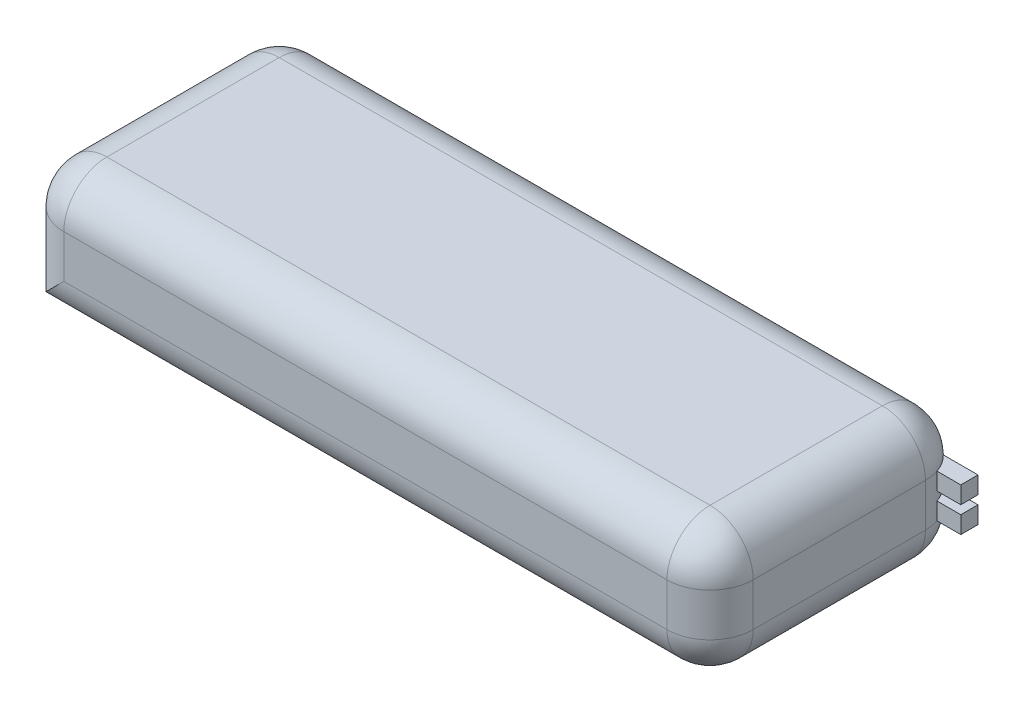
from build123d import *

# Parameters (mm, degrees)
ESQUISSE1_W        = 160
ESQUISSE1_H        = 60
BOSS_EXTRU_1_DEPTH = 30
ESQUISSE2_W        = 4
ESQUISSE2_H        = 4
BOSS_EXTRU_2_DEPTH = 5
CONG_1_R           = 10


with BuildPart() as part:
    # Esquisse1 → Boss.-Extru.1 (new body)
    with BuildSketch(Plane(origin=(0, 0, 0), x_dir=(1, 0, 0), z_dir=(0, 1, 0))):
        Rectangle(ESQUISSE1_W, ESQUISSE1_H)
    extrude(amount=BOSS_EXTRU_1_DEPTH)

    # Esquisse2 → Boss.-Extru.2 (add)
    with BuildSketch(Plane(origin=(80, 0, 0), x_dir=(0, 0, -1), z_dir=(1, 0, 0))):
        with Locations((25.192260315, 18)):
            Rectangle(ESQUISSE2_W, ESQUISSE2_H)
        with Locations((25.192260315, 12)):
            Rectangle(ESQUISSE2_W, ESQUISSE2_H)
    extrude(amount=BOSS_EXTRU_2_DEPTH)

    # Congé1
    # the kernel refuses this fillet: 10 mm, written as the material it takes off along each edge
    with BuildSketch(Plane(origin=(-70, 20, 20), x_dir=(-1, 0, 0), z_dir=(0, 0, 1))) as cong_1_piece_1_section:
        Polygon((0, 0), (CONG_1_R * 1.02, 0), (CONG_1_R * 1.02, -CONG_1_R * 1.02), (0, -CONG_1_R * 1.02), align=None)
    cong_1_piece_1 = extrude(amount=CONG_1_R * 1.02, mode=Mode.PRIVATE)
    cong_1_piece_1 = cong_1_piece_1 - Plane(origin=(-70, 20, 20), x_dir=(0.7071067811865475, -0.7071067811865475, 0), z_dir=(0, 0, 1)) * Sphere(CONG_1_R, mode=Mode.PRIVATE)
    add(cong_1_piece_1, mode=Mode.SUBTRACT)
    with BuildSketch(Plane(origin=(-70, 20, -20), x_dir=(0, 1, 0), z_dir=(-1, 0, 0))) as cong_1_piece_2_section:
        Polygon((0, 0), (CONG_1_R * 1.02, 0), (CONG_1_R * 1.02, CONG_1_R * 1.02), (0, CONG_1_R * 1.02), align=None)
    cong_1_piece_2 = extrude(amount=CONG_1_R * 1.02, mode=Mode.PRIVATE)
    cong_1_piece_2 = cong_1_piece_2 - Plane(origin=(-70, 20, -20), x_dir=(0, -0.7071067811865475, 0.7071067811865475), z_dir=(-1, 0, 0)) * Sphere(CONG_1_R, mode=Mode.PRIVATE)
    add(cong_1_piece_2, mode=Mode.SUBTRACT)
    with BuildSketch(Plane(origin=(70, 10, -20), x_dir=(0, -1, 0), z_dir=(1, 0, 0))) as cong_1_piece_3_section:
        Polygon((0, 0), (CONG_1_R * 1.02, 0), (CONG_1_R * 1.02, CONG_1_R * 1.02), (0, CONG_1_R * 1.02), align=None)
    cong_1_piece_3 = extrude(amount=CONG_1_R * 1.02, mode=Mode.PRIVATE)
    cong_1_piece_3 = cong_1_piece_3 - Plane(origin=(70, 10, -20), x_dir=(0, 0.7071067811865475, 0.7071067811865475), z_dir=(1, 0, 0)) * Sphere(CONG_1_R, mode=Mode.PRIVATE)
    add(cong_1_piece_3, mode=Mode.SUBTRACT)
    with BuildSketch(Plane(origin=(70, 20, -20), x_dir=(0, 1, 0), z_dir=(1, 0, 0))) as cong_1_piece_4_section:
        Polygon((0, 0), (CONG_1_R * 1.02, 0), (CONG_1_R * 1.02, -CONG_1_R * 1.02), (0, -CONG_1_R * 1.02), align=None)
    cong_1_piece_4 = extrude(amount=CONG_1_R * 1.02, mode=Mode.PRIVATE)
    cong_1_piece_4 = cong_1_piece_4 - Plane(origin=(70, 20, -20), x_dir=(0, -0.7071067811865475, 0.7071067811865475), z_dir=(1, 0, 0)) * Sphere(CONG_1_R, mode=Mode.PRIVATE)
    add(cong_1_piece_4, mode=Mode.SUBTRACT)
    with BuildSketch(Plane(origin=(70, 10, 20), x_dir=(1, 0, 0), z_dir=(0, 0, 1))) as cong_1_piece_5_section:
        Polygon((0, 0), (CONG_1_R * 1.02, 0), (CONG_1_R * 1.02, -CONG_1_R * 1.02), (0, -CONG_1_R * 1.02), align=None)
    cong_1_piece_5 = extrude(amount=CONG_1_R * 1.02, mode=Mode.PRIVATE)
    cong_1_piece_5 = cong_1_piece_5 - Plane(origin=(70, 10, 20), x_dir=(-0.7071067811865475, 0.7071067811865475, 0), z_dir=(0, 0, 1)) * Sphere(CONG_1_R, mode=Mode.PRIVATE)
    add(cong_1_piece_5, mode=Mode.SUBTRACT)
    with BuildSketch(Plane(origin=(70, 20, 20), x_dir=(1, 0, 0), z_dir=(0, 0, 1))) as cong_1_piece_6_section:
        Polygon((0, 0), (CONG_1_R * 1.02, 0), (CONG_1_R * 1.02, CONG_1_R * 1.02), (0, CONG_1_R * 1.02), align=None)
    cong_1_piece_6 = extrude(amount=CONG_1_R * 1.02, mode=Mode.PRIVATE)
    cong_1_piece_6 = cong_1_piece_6 - Plane(origin=(70, 20, 20), x_dir=(-0.7071067811865475, -0.7071067811865475, 0), z_dir=(0, 0, 1)) * Sphere(CONG_1_R, mode=Mode.PRIVATE)
    add(cong_1_piece_6, mode=Mode.SUBTRACT)
    with BuildSketch(Plane(origin=(-80, -25, 30), x_dir=(1, 0, 0), z_dir=(0, 1, 0)), Plane(origin=(-80, -25, -30), x_dir=(0, 0, 1), z_dir=(0, 1, 0))) as cong_1_piece_7:
        with BuildLine():
            CenterArc((CONG_1_R, CONG_1_R), CONG_1_R, 180, 90)
            Line((0, CONG_1_R), (0, 0))
            Line((0, 0), (CONG_1_R, 0))
        make_face()
    extrude(amount=45, mode=Mode.SUBTRACT)
    with BuildSketch(Plane(origin=(70, 0, -30), x_dir=(0, 0, 1), z_dir=(-1, 0, 0))) as cong_1_piece_8:
        with BuildLine():
            CenterArc((CONG_1_R, CONG_1_R), CONG_1_R, 180, 90)
            Line((0, CONG_1_R), (0, 0))
            Line((0, 0), (CONG_1_R, 0))
        make_face()
    extrude(amount=175, mode=Mode.SUBTRACT)
    with BuildSketch(Plane(origin=(80, 10, -30), x_dir=(0, 0, 1), z_dir=(0, 1, 0))) as cong_1_piece_9_section:
        with BuildLine():
            CenterArc((CONG_1_R, -CONG_1_R), CONG_1_R, 90, 90)
            Line((0, -CONG_1_R), (0, 0))
            Line((0, 0), (CONG_1_R, 0))
        make_face()
    cong_1_piece_9 = extrude(amount=10, mode=Mode.PRIVATE)
    cong_1_piece_9 = split(cong_1_piece_9, bisect_by=Plane(origin=(79.843765754, 12, -23.192260315), z_dir=(0, 0, 1)), keep=Keep.TOP, mode=Mode.PRIVATE)
    add(cong_1_piece_9, mode=Mode.SUBTRACT)
    with BuildSketch(Plane(origin=(80, 10, -30), x_dir=(0, 0, 1), z_dir=(0, 1, 0))) as cong_1_piece_10_section:
        with BuildLine():
            CenterArc((CONG_1_R, -CONG_1_R), CONG_1_R, 90, 90)
            Line((0, -CONG_1_R), (0, 0))
            Line((0, 0), (CONG_1_R, 0))
        make_face()
    cong_1_piece_10 = extrude(amount=10, mode=Mode.PRIVATE)
    cong_1_piece_10 = split(cong_1_piece_10, bisect_by=Plane(origin=(77.140541655, 12, -27.192260315), z_dir=(0, 0, -1)), keep=Keep.TOP, mode=Mode.PRIVATE)
    add(cong_1_piece_10, mode=Mode.SUBTRACT)
    with BuildSketch(Plane(origin=(80, 10, -30), x_dir=(0, 0, 1), z_dir=(0, 1, 0))) as cong_1_piece_11_section:
        with BuildLine():
            CenterArc((CONG_1_R, -CONG_1_R), CONG_1_R, 90, 90)
            Line((0, -CONG_1_R), (0, 0))
            Line((0, 0), (CONG_1_R, 0))
        make_face()
    cong_1_piece_11 = extrude(amount=10, mode=Mode.PRIVATE)
    cong_1_piece_11 = split(cong_1_piece_11, bisect_by=Plane(origin=(79.050284637, 16, -25.722845845), z_dir=(0, -1, 0)), keep=Keep.TOP, mode=Mode.PRIVATE)
    cong_1_piece_11 = split(cong_1_piece_11, bisect_by=Plane(origin=(79.050284637, 14, -25.722845845), z_dir=(0, 1, 0)), keep=Keep.TOP, mode=Mode.PRIVATE)
    add(cong_1_piece_11, mode=Mode.SUBTRACT)
    with BuildSketch(Plane(origin=(80, 0, 20), x_dir=(0, 1, 0), z_dir=(0, 0, -1))) as cong_1_piece_12:
        with BuildLine():
            CenterArc((CONG_1_R, -CONG_1_R), CONG_1_R, 90, 90)
            Line((0, -CONG_1_R), (0, 0))
            Line((0, 0), (CONG_1_R, 0))
        make_face()
    extrude(amount=40, mode=Mode.SUBTRACT)
    with BuildSketch(Plane(origin=(80, 30, 20), x_dir=(0, -1, 0), z_dir=(0, 0, -1)), Plane(origin=(-80, 30, -20), x_dir=(0, -1, 0), z_dir=(0, 0, 1))) as cong_1_piece_13:
        with BuildLine():
            CenterArc((CONG_1_R, CONG_1_R), CONG_1_R, 180, 90)
            Line((0, CONG_1_R), (0, 0))
            Line((0, 0), (CONG_1_R, 0))
        make_face()
    extrude(amount=40, mode=Mode.SUBTRACT)
    with BuildSketch(Plane(origin=(70, 30, -30), x_dir=(0, 0, 1), z_dir=(-1, 0, 0))) as cong_1_piece_14:
        with BuildLine():
            CenterArc((CONG_1_R, -CONG_1_R), CONG_1_R, 90, 90)
            Line((0, -CONG_1_R), (0, 0))
            Line((0, 0), (CONG_1_R, 0))
        make_face()
    extrude(amount=140, mode=Mode.SUBTRACT)
    with BuildSketch(Plane(origin=(80, 10, 30), x_dir=(-1, 0, 0), z_dir=(0, 1, 0))) as cong_1_piece_15:
        with BuildLine():
            CenterArc((CONG_1_R, -CONG_1_R), CONG_1_R, 90, 90)
            Line((0, -CONG_1_R), (0, 0))
            Line((0, 0), (CONG_1_R, 0))
        make_face()
    extrude(amount=10, mode=Mode.SUBTRACT)
    with BuildSketch(Plane(origin=(-105, 0, 30), x_dir=(0, 1, 0), z_dir=(1, 0, 0))) as cong_1_piece_16:
        with BuildLine():
            CenterArc((CONG_1_R, -CONG_1_R), CONG_1_R, 90, 90)
            Line((0, -CONG_1_R), (0, 0))
            Line((0, 0), (CONG_1_R, 0))
        make_face()
    extrude(amount=175, mode=Mode.SUBTRACT)
    with BuildSketch(Plane(origin=(-70, 30, 30), x_dir=(0, -1, 0), z_dir=(1, 0, 0))) as cong_1_piece_17:
        with BuildLine():
            CenterArc((CONG_1_R, CONG_1_R), CONG_1_R, 180, 90)
            Line((0, CONG_1_R), (0, 0))
            Line((0, 0), (CONG_1_R, 0))
        make_face()
    extrude(amount=140, mode=Mode.SUBTRACT)


solid = part.part
